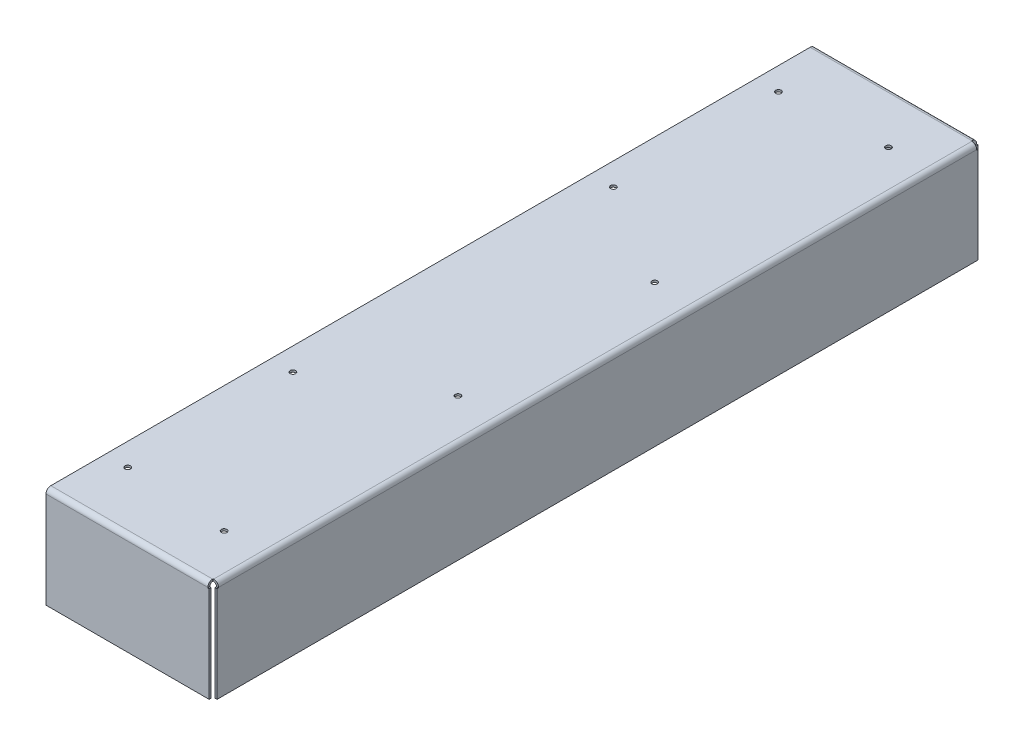
from build123d import *

# Parameters (mm, degrees)
SKETCH_1_W                  = 120
SKETCH_1_H                  = 556
EXTRUDE_1_DEPTH             = 72
SHEET_START                 = 58.585786438
SHEET_METAL_1_DEPTH         = 2.914213562
SHEET_START_2               = -60
SHEET_METAL_1_2_DEPTH       = 118
SHEET_START_3               = 57.625
SHEET_METAL_1_3_DEPTH       = 0.960786438
SHEET_METAL_1_4_DEPTH       = 117.625
SHEET_METAL_1_5_OUTLINE_W   = 69.625
SHEET_METAL_1_5_OUTLINE_H   = 1.5
SHEET_METAL_1_5_OUTLINE_W_2 = 1.5
SHEET_METAL_1_5_OUTLINE_H_2 = 551.25
SHEET_METAL_1_5_DEPTH       = 0.375
SHEET_METAL_1_6_OUTLINE_W   = 69.625
SHEET_METAL_1_6_OUTLINE_H   = 1.5
SHEET_METAL_1_6_DEPTH       = 0.960786438
SHEET_START_4               = -276.585786438
SHEET_METAL_1_7_DEPTH       = 553.171572876
SHEET_START_5               = -275.625
SHEET_METAL_1_8_DEPTH       = 551.25
SHEET_METAL_1_9_OUTLINE_W   = 1.5
SHEET_METAL_1_9_OUTLINE_H   = 69.625
SHEET_METAL_1_9_DEPTH       = 553.171572876
SKETCH_6_R                  = 2
CUT_EXTRUDE_1_DEPTH         = 296.473772102


with BuildPart() as part:
    # Sketch 1 → 凸台-拉伸1 (new body)
    with BuildSketch(Plane(origin=(0, 0, 0), x_dir=(1, 0, 0), z_dir=(0, 1, 0))):
        Rectangle(SKETCH_1_W, SKETCH_1_H)
    extrude(amount=EXTRUDE_1_DEPTH)

    # Sheet Metal 1: read off the stored shape, not the designer's step
    # Sheet Metal 1 outline → Sheet Metal 1 (cut)
    with BuildSketch(Plane.YZ.offset(SHEET_START)):
        with BuildLine():
            Line((0, 279.5), (0, 276.585786438))
            Line((0, 276.585786438), (69.625, 276.585786438))
            Line((69.625, 276.585786438), (69.625, 275.625))
            Line((69.625, 275.625), (73.5, 275.625))
            Line((73.5, 275.625), (73.5, 276))
            ThreePointArc((73.5, 276), (72.474873734, 278.474873734), (70, 279.5))
            Line((70, 279.5), (69.625, 279.5))
            Line((69.625, 279.5), (0, 279.5))
        make_face()
        with BuildLine():
            Line((69.625, -276.585786438), (0, -276.585786438))
            Line((0, -276.585786438), (0, -279.5))
            Line((0, -279.5), (69.625, -279.5))
            Line((69.625, -279.5), (70, -279.5))
            ThreePointArc((70, -279.5), (72.474873734, -278.474873734), (73.5, -276))
            Line((73.5, -276), (73.5, -275.625))
            Line((73.5, -275.625), (69.625, -275.625))
            Line((69.625, -275.625), (69.625, -276.585786438))
        make_face()
    extrude(amount=SHEET_METAL_1_DEPTH, mode=Mode.SUBTRACT)

    # Sheet Metal 1 2 outline → Sheet Metal 1 2 (cut)
    with BuildSketch(Plane.YZ.offset(SHEET_START_2)):
        with BuildLine():
            Line((0, 278), (0, -278))
            Line((0, -278), (70, -278))
            ThreePointArc((70, -278), (71.414213562, -277.414213562), (72, -276))
            Line((72, -276), (72, 276))
            ThreePointArc((72, 276), (71.414213562, 277.414213562), (70, 278))
            Line((70, 278), (0, 278))
        make_face()
    extrude(amount=SHEET_METAL_1_2_DEPTH, mode=Mode.SUBTRACT)

    # Sheet Metal 1 3 outline → Sheet Metal 1 3 (cut)
    with BuildSketch(Plane.YZ.offset(SHEET_START_3)):
        Polygon((0, 278), (0, 276.585786438), (69.625, 276.585786438), (69.625, 275.625), (72, 275.625), (72, 278), align=None)
        Polygon((69.625, -276.585786438), (0, -276.585786438), (0, -278), (72, -278), (72, -275.625), (69.625, -275.625), align=None)
    extrude(amount=SHEET_METAL_1_3_DEPTH, mode=Mode.SUBTRACT)

    # Sheet Metal 1 4 outline → Sheet Metal 1 4 (add)
    with BuildSketch(Plane.YZ.offset(SHEET_START_2)):
        with BuildLine():
            Line((0, 279.5), (0, 278))
            Line((0, 278), (72, 278))
            Line((72, 278), (72, -278))
            Line((72, -278), (0, -278))
            Line((0, -278), (0, -279.5))
            Line((0, -279.5), (70, -279.5))
            ThreePointArc((70, -279.5), (72.474873734, -278.474873734), (73.5, -276))
            Line((73.5, -276), (73.5, 276))
            ThreePointArc((73.5, 276), (72.474873734, 278.474873734), (70, 279.5))
            Line((70, 279.5), (0, 279.5))
        make_face()
    extrude(amount=SHEET_METAL_1_4_DEPTH)

    # Sheet Metal 1 5 outline → Sheet Metal 1 5 (add)
    with BuildSketch(Plane.YZ.offset(SHEET_START_3)):
        with Locations((34.8125, 278.75)):
            Rectangle(SHEET_METAL_1_5_OUTLINE_W, SHEET_METAL_1_5_OUTLINE_H)
        with Locations((34.8125, -278.75)):
            Rectangle(SHEET_METAL_1_5_OUTLINE_W, SHEET_METAL_1_5_OUTLINE_H)
        with Locations((72.75, 0)):
            Rectangle(SHEET_METAL_1_5_OUTLINE_W_2, SHEET_METAL_1_5_OUTLINE_H_2)
    extrude(amount=SHEET_METAL_1_5_DEPTH)

    # Sheet Metal 1 6 outline → Sheet Metal 1 6 (add)
    with BuildSketch(Plane.YZ.offset(SHEET_START_3)):
        with Locations((34.8125, 278.75)):
            Rectangle(SHEET_METAL_1_6_OUTLINE_W, SHEET_METAL_1_6_OUTLINE_H)
        with Locations((34.8125, -278.75)):
            Rectangle(SHEET_METAL_1_6_OUTLINE_W, SHEET_METAL_1_6_OUTLINE_H)
    extrude(amount=SHEET_METAL_1_6_DEPTH)

    # Sheet Metal 1 7 outline → Sheet Metal 1 7 (cut)
    with BuildSketch(Plane.XY.offset(SHEET_START_4)):
        with BuildLine():
            Line((58, 0), (60, 0))
            Line((60, 0), (60, 70))
            ThreePointArc((60, 70), (59.414213562, 71.414213562), (58, 72))
            Line((58, 72), (58, 0))
        make_face()
    extrude(amount=SHEET_METAL_1_7_DEPTH, mode=Mode.SUBTRACT)

    # Sheet Metal 1 8 outline → Sheet Metal 1 8 (add)
    with BuildSketch(Plane.XY.offset(SHEET_START_5)):
        with BuildLine():
            Line((60, 0), (61.5, 0))
            Line((61.5, 0), (61.5, 70))
            ThreePointArc((61.5, 70), (60.474873734, 72.474873734), (58, 73.5))
            Line((58, 73.5), (58, 72))
            Line((58, 72), (60, 72))
            Line((60, 72), (60, 0))
        make_face()
    extrude(amount=SHEET_METAL_1_8_DEPTH)

    # Sheet Metal 1 9 outline → Sheet Metal 1 9 (add)
    with BuildSketch(Plane.XY.offset(SHEET_START_4)):
        with Locations((60.75, 34.8125)):
            Rectangle(SHEET_METAL_1_9_OUTLINE_W, SHEET_METAL_1_9_OUTLINE_H)
    extrude(amount=SHEET_METAL_1_9_DEPTH)

    # 草图6 → 切除-拉伸1 (cut, through all)
    with BuildSketch(Plane(origin=(0, 0, 0), x_dir=(1, 0, 0), z_dir=(0, 1, 0))):
        with Locations(Location((-43.5, -236.5, 0), (0, 0, 270))):
            Circle(SKETCH_6_R)
        with Locations(Location((31.5, -241.5, 0), (0, 0, 270))):
            Circle(SKETCH_6_R)
        with Locations(Location((-43.5, -116.5, 0), (0, 0, 270))):
            Circle(SKETCH_6_R)
        with Locations(Location((31.5, -71.5, 0), (0, 0, 270))):
            Circle(SKETCH_6_R)
        with Locations(Location((31.5, 71.5, 0), (0, 0, 90))):
            Circle(SKETCH_6_R)
        with Locations(Location((-43.5, 116.5, 0), (0, 0, 90))):
            Circle(SKETCH_6_R)
        with Locations(Location((31.5, 241.5, 0), (0, 0, 90))):
            Circle(SKETCH_6_R)
        with Locations(Location((-43.5, 236.5, 0), (0, 0, 90))):
            Circle(SKETCH_6_R)
    extrude(amount=CUT_EXTRUDE_1_DEPTH, mode=Mode.SUBTRACT)


solid = part.part
